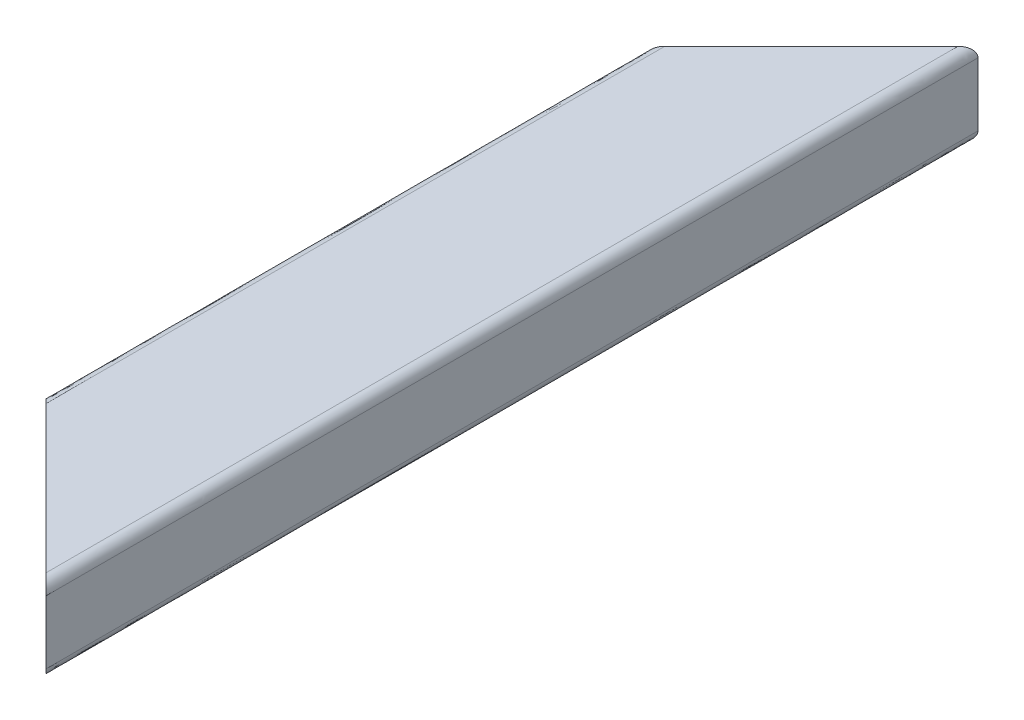
from build123d import *

# Parameters (mm, degrees)
SKETCH1_W           = 50.8
SKETCH1_H           = 25.4
SKETCH1_W_2         = 44.704
SKETCH1_H_2         = 19.304
BOSS_EXTRUDE1_DEPTH = 304.8
CUT_EXTRUDE1_DEPTH  = 304.8
VARFILLET1_R        = 3.048


with BuildPart() as part:
    # Sketch1 → Boss-Extrude1 (new body)
    with BuildSketch(Plane.XY):
        with Locations((22.352, 9.652)):
            Rectangle(SKETCH1_W, SKETCH1_H)
        with Locations((22.352, 9.652)):
            Rectangle(SKETCH1_W_2, SKETCH1_H_2, mode=Mode.SUBTRACT)
    extrude(amount=BOSS_EXTRUDE1_DEPTH)

    # Sketch3 → Cut-Extrude1 (cut)
    with BuildSketch(Plane(origin=(0, 22.352, 0), x_dir=(1, 0, 0), z_dir=(0, 1, 0))):
        Polygon((47.752, -296.986659264), (-3.048, -246.186659264), (-3.048, -304.8), (47.752, -304.8), align=None)
        Polygon((-3.048, -63.5), (47.752, -12.7), (47.752, 0), (-3.048, 0), align=None)
    extrude(amount=-CUT_EXTRUDE1_DEPTH, mode=Mode.SUBTRACT)

    # VarFillet1
    varfillet1_edges = [part.edges().sort_by_distance(p)[0] for p in [
        (0, 19.304, 154.843329632),
        (0, 0, 154.843329632),
        (44.704, 19.304, 154.843329632),
        (44.704, 0, 154.843329632),
        (47.752, -3.048, 154.843329632),
        (47.752, 22.352, 154.843329632),
        (-3.048, 22.352, 154.843329632),
        (-3.048, -3.048, 154.843329632),
    ]]
    fillet(varfillet1_edges, radius=VARFILLET1_R)


solid = part.part
